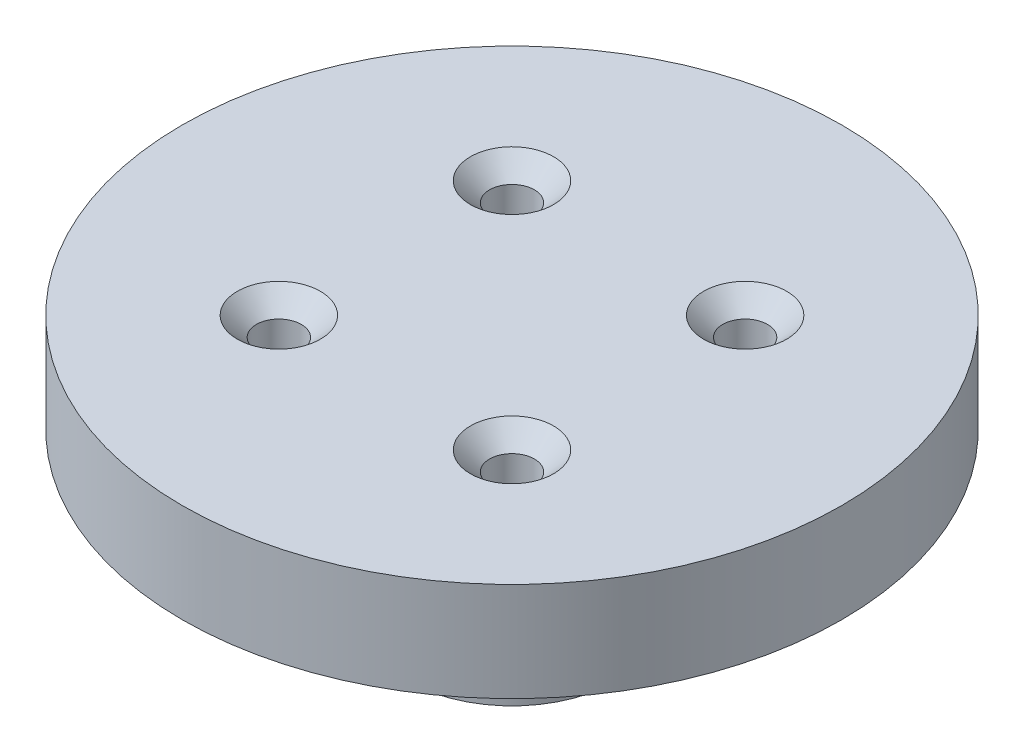
from build123d import *

# Parameters (mm, degrees)
SKETCH1_R                                      = 25
BOSS_EXTRUDE1_DEPTH                            = 7.5
CSK_FOR_M3_FLAT_HEAD_MACHINE_SCREW1_AT_2_COUNT = 2
CSK_FOR_M3_FLAT_HEAD_MACHINE_SCREW1_AT_2_PITCH = 17.67766953
CSK_FOR_M3_FLAT_HEAD_MACHINE_SCREW1_AT_3_COUNT = 2
CSK_FOR_M3_FLAT_HEAD_MACHINE_SCREW1_AT_3_PITCH = 25
CSK_FOR_M3_FLAT_HEAD_MACHINE_SCREW1_AT_4_COUNT = 2
CSK_FOR_M3_FLAT_HEAD_MACHINE_SCREW1_AT_4_PITCH = 17.67766953
SKETCH6_R                                      = 8
BOSS_EXTRUDE2_DEPTH                            = 12.5
SKETCH7_R                                      = 1
CUT_EXTRUDE1_DEPTH                             = 10.5


with BuildPart() as part:
    # Sketch1 → Boss-Extrude1 (new body)
    with BuildSketch(Plane(origin=(0, 0, 0), x_dir=(1, 0, 0), z_dir=(0, 1, 0))):
        Circle(SKETCH1_R)
    extrude(amount=BOSS_EXTRUDE1_DEPTH)

    # Sketch5 → CSK for M3 Flat Head Machine Screw1 (revolve, cut)
    with BuildSketch(Plane(origin=(-8.838834765, 7.5, -8.838834765), x_dir=(0, 0, 1), z_dir=(1, 0, 0))):
        Polygon((0, 0), (0, 7.5), (1.725, 7.5), (1.7, 7.475), (1.7, 1.45), (3.15, 0), align=None)
    csk_for_m3_flat_head_machine_screw1 = revolve(axis=Axis((-8.838834765, 13.85, -8.838834765), (0, -1, 0)), mode=Mode.SUBTRACT)

    # CSK for M3 Flat Head Machine Screw1 at 2: CSK for M3 Flat Head Machine Screw1 ×2
    with Locations(*[(i * CSK_FOR_M3_FLAT_HEAD_MACHINE_SCREW1_AT_2_PITCH, 0, 0) for i in range(1, CSK_FOR_M3_FLAT_HEAD_MACHINE_SCREW1_AT_2_COUNT)]):
        add(csk_for_m3_flat_head_machine_screw1, mode=Mode.SUBTRACT)

    # CSK for M3 Flat Head Machine Screw1 at 3: CSK for M3 Flat Head Machine Screw1 ×2
    with Locations(*[Vector(0.7071067811865575, 0, 0.7071067811865376) * (i * CSK_FOR_M3_FLAT_HEAD_MACHINE_SCREW1_AT_3_PITCH) for i in range(1, CSK_FOR_M3_FLAT_HEAD_MACHINE_SCREW1_AT_3_COUNT)]):
        add(csk_for_m3_flat_head_machine_screw1, mode=Mode.SUBTRACT)

    # CSK for M3 Flat Head Machine Screw1 at 4: CSK for M3 Flat Head Machine Screw1 ×2
    with Locations(*[(0, 0, i * CSK_FOR_M3_FLAT_HEAD_MACHINE_SCREW1_AT_4_PITCH) for i in range(1, CSK_FOR_M3_FLAT_HEAD_MACHINE_SCREW1_AT_4_COUNT)]):
        add(csk_for_m3_flat_head_machine_screw1, mode=Mode.SUBTRACT)

    # Sketch6 → Boss-Extrude2 (add)
    with BuildSketch(Plane.XZ):
        Circle(SKETCH6_R)
        with BuildLine():
            Line((-4.330127019, 2.5), (4.330127019, 2.5))
            ThreePointArc((4.330127019, 2.5), (0, -5), (-4.330127019, 2.5))
        make_face(mode=Mode.SUBTRACT)
    extrude(amount=BOSS_EXTRUDE2_DEPTH)

    # Sketch7 → Cut-Extrude1 (cut)
    with BuildSketch(Plane.XY):
        with Locations((0, -6.25)):
            Circle(SKETCH7_R)
    extrude(amount=CUT_EXTRUDE1_DEPTH, mode=Mode.SUBTRACT)


solid = part.part
